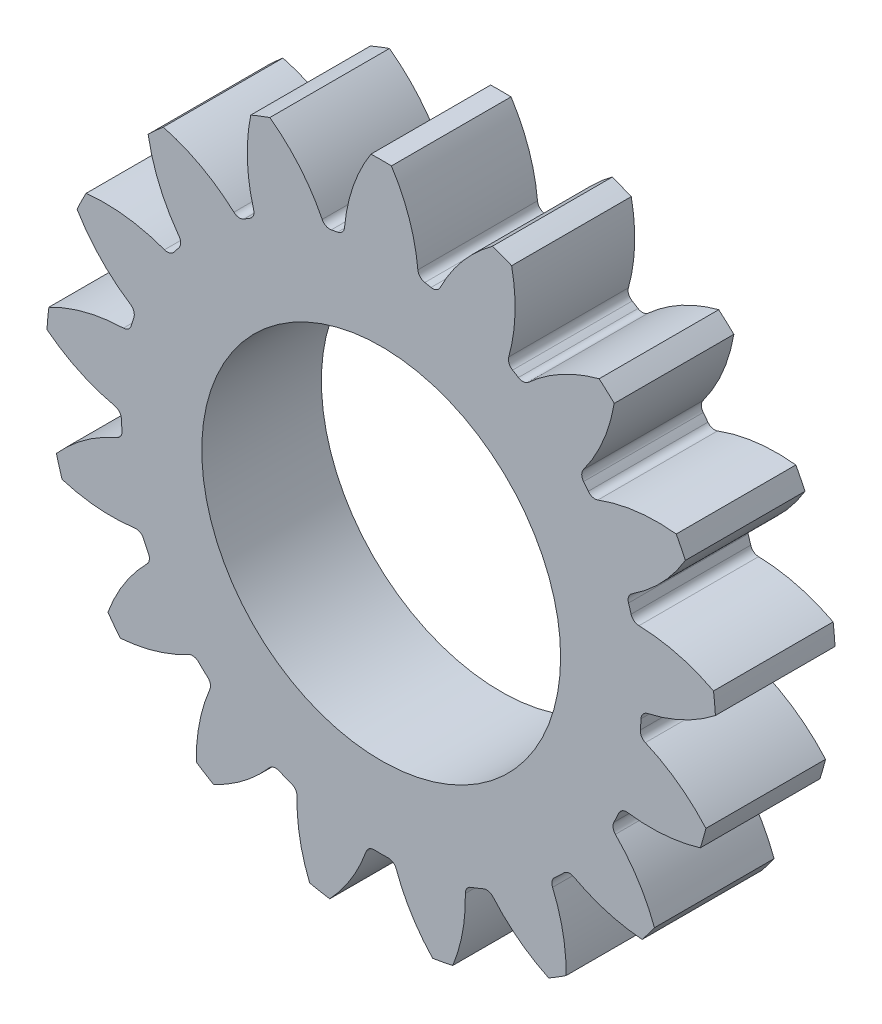
from build123d import *

# Parameters (mm, degrees)
SKETCH_1_R               = 10.875
EXTRUDE_1_DEPTH          = 5
EXTRUDE_2_DEPTH          = 5
FILLET_1_R               = 0.35
PATTERN_CIRCULAR_1_DEPTH = 5
CUT_EXTRUDE_1_REACH      = 22.572
SKETCH_2_R               = 7.5


# Read off the part's stored shape, not the designer's step: 원형 패턴1
with BuildPart() as part:
    # 스케치1 → 보스-돌출1 (new body)
    with BuildSketch(Plane.XY):
        Circle(SKETCH_1_R)
    extrude(amount=EXTRUDE_1_DEPTH)

    # 스케치1<3> → 보스-돌출2 (add)
    with BuildSketch(Plane.XY):
        with BuildLine():
            ThreePointArc((1.5525, 10.763613183), (1.216970842, 12.576974386), (0.4275, 14.243586057))
            ThreePointArc((0.4275, 14.243586057), (0, 14.25), (-0.4275, 14.243586057))
            ThreePointArc((-0.4275, 14.243586057), (-1.216970842, 12.576974386), (-1.5525, 10.763613183))
            ThreePointArc((-1.5525, 10.763613183), (0, 10.875), (1.5525, 10.763613183))
        make_face()
    extrude(amount=EXTRUDE_2_DEPTH)

    # 필렛1
    fillet_1_edges = [part.edges().sort_by_distance(p)[0] for p in [
        (-1.5525, 10.763613183, 2.5),
        (1.5525, 10.763613183, 2.5),
    ]]
    fillet(fillet_1_edges, radius=FILLET_1_R)

    # 원형 패턴1 outline → 원형 패턴1 (add)
    with BuildSketch(Plane.XY):
        with BuildLine():
            ThreePointArc((2.084837088, 10.673288121), (3.842906104, 10.173381821), (5.492422476, 9.386102511))
            ThreePointArc((5.492422476, 9.386102511), (5.344646109, 9.557145045), (5.332233471, 9.782842475))
            ThreePointArc((5.332233471, 9.782842475), (5.593355494, 11.4564781), (5.452236305, 13.144472855))
            ThreePointArc((5.452236305, 13.144472855), (5.055921411, 13.304884491), (4.654972549, 13.453334479))
            ThreePointArc((4.654972549, 13.453334479), (3.403689946, 12.289385973), (2.465385752, 10.861075951))
            ThreePointArc((2.465385752, 10.861075951), (2.306817266, 10.702930709), (2.084837088, 10.673288121))
        make_face()
        with BuildLine():
            ThreePointArc((5.736195698, 9.2391387), (7.199095251, 8.150990895), (8.459646862, 6.833739823))
            ThreePointArc((8.459646862, 6.833739823), (8.381997736, 7.045900933), (8.450146114, 7.261301773))
            ThreePointArc((8.450146114, 7.261301773), (9.274201483, 8.707038787), (9.740617886, 10.304436202))
            ThreePointArc((9.740617886, 10.304436202), (9.42901262, 10.597181051), (9.108765262, 10.880445977))
            ThreePointArc((9.108765262, 10.880445977), (7.536352291, 10.255192371), (6.155612256, 9.27693802))
            ThreePointArc((6.155612256, 9.27693802), (5.952224819, 9.187903085), (5.736195698, 9.2391387))
        make_face()
        with BuildLine():
            ThreePointArc((8.656847778, 6.582143386), (9.631277253, 5.050160738), (10.337248772, 3.377412148))
            ThreePointArc((10.337248772, 3.377412148), (10.339832595, 3.602419922), (10.478866532, 3.779351375))
            ThreePointArc((10.478866532, 3.779351375), (11.729603042, 4.815098477), (12.713475046, 6.107038785))
            ThreePointArc((12.713475046, 6.107038785), (12.528663426, 6.492580033), (12.332368752, 6.872403399))
            ThreePointArc((12.332368752, 6.872403399), (10.671238348, 6.86130469), (9.057778331, 6.466052652))
            ThreePointArc((9.057778331, 6.466052652), (8.838113972, 6.457792134), (8.656847778, 6.582143386))
        make_face()
        with BuildLine():
            ThreePointArc((10.44566348, 3.025514743), (10.802249116, 1.255802147), (10.861158072, -0.548516485))
            ThreePointArc((10.861158072, -0.548516485), (10.943077602, -0.34062274), (11.134084318, -0.224661311))
            ThreePointArc((11.134084318, -0.224661311), (12.626546762, 0.289328326), (13.969306954, 1.119162384))
            ThreePointArc((13.969306954, 1.119162384), (13.936248813, 1.545430549), (13.890417506, 1.970515105))
            ThreePointArc((13.890417506, 1.970515105), (12.377771936, 2.549980076), (10.773358461, 2.772990553))
            ThreePointArc((10.773358461, 2.772990553), (10.568207288, 2.845653785), (10.44566348, 3.025514743))
        make_face()
        with BuildLine():
            ThreePointArc((10.831434222, -0.972449329), (10.524388312, -2.739137757), (9.931200049, -4.431353133))
            ThreePointArc((9.931200049, -4.431353133), (10.080749628, -4.26807205), (10.298365111, -4.227215102))
            ThreePointArc((10.298365111, -4.227215102), (11.831510548, -4.270865326), (13.338506551, -3.985552654))
            ThreePointArc((13.338506551, -3.985552654), (13.461666574, -3.57612745), (13.572488407, -3.163191729))
            ThreePointArc((13.572488407, -3.163191729), (12.409057254, -2.103647039), (11.041512467, -1.325168872))
            ThreePointArc((11.041512467, -1.325168872), (10.879326869, -1.182845296), (10.831434222, -0.972449329))
        make_face()
        with BuildLine():
            ThreePointArc((9.724818044, -4.867600951), (8.799895988, -6.389636578), (7.638946645, -7.74029193))
            ThreePointArc((7.638946645, -7.74029193), (7.835322049, -7.642919348), (8.051101932, -7.68143897))
            ThreePointArc((8.051101932, -7.68143897), (9.434573038, -8.250170344), (10.906266927, -8.517686277))
            ThreePointArc((10.906266927, -8.517686277), (11.169011671, -8.180399177), (11.421519541, -7.835381548))
            ThreePointArc((11.421519541, -7.835381548), (10.743744256, -6.465085659), (9.78938361, -5.27081353))
            ThreePointArc((9.78938361, -5.27081353), (9.692203368, -5.079599132), (9.724818044, -4.867600951))
        make_face()
        with BuildLine():
            ThreePointArc((7.250855805, -8.104980882), (5.839114845, -9.174440736), (4.272503154, -10.000567074))
            ThreePointArc((4.272503154, -10.000567074), (4.488726043, -9.981391229), (4.674670149, -10.09339498))
            ThreePointArc((4.674670149, -10.09339498), (5.746046713, -11.099844355), (7.00107552, -11.865148727))
            ThreePointArc((7.00107552, -11.865148727), (7.367919852, -11.645552222), (7.728011172, -11.415049228))
            ThreePointArc((7.728011172, -11.415049228), (7.598229184, -9.929070664), (7.162058655, -8.502630716))
            ThreePointArc((7.162058655, -8.502630716), (7.142629708, -8.289552802), (7.250855805, -8.104980882))
        make_face()
        with BuildLine():
            ThreePointArc((3.745858716, -10.209513577), (2.04453627, -10.681081239), (0.289330355, -10.871150489))
            ThreePointArc((0.289330355, -10.871150489), (0.495925275, -10.93192564), (0.627834307, -11.102146342))
            ThreePointArc((0.627834307, -11.102146342), (1.261761796, -12.417365945), (2.150350071, -13.57584665))
            ThreePointArc((2.150350071, -13.57584665), (2.57174963, -13.503598465), (2.990792071, -13.418740812))
            ThreePointArc((2.990792071, -13.418740812), (3.40225572, -12.010026536), (3.516526006, -10.546906395))
            ThreePointArc((3.516526006, -10.546906395), (3.576953157, -10.341342504), (3.745858716, -10.209513577))
        make_face()
        with BuildLine():
            ThreePointArc((-0.289330355, -10.871150489), (-2.04453627, -10.681081239), (-3.745858716, -10.209513577))
            ThreePointArc((-3.745858716, -10.209513577), (-3.576953157, -10.341342504), (-3.516526006, -10.546906395))
            ThreePointArc((-3.516526006, -10.546906395), (-3.40225572, -12.010026536), (-2.990792071, -13.418740812))
            ThreePointArc((-2.990792071, -13.418740812), (-2.57174963, -13.503598465), (-2.150350071, -13.57584665))
            ThreePointArc((-2.150350071, -13.57584665), (-1.261761796, -12.417365945), (-0.627834307, -11.102146342))
            ThreePointArc((-0.627834307, -11.102146342), (-0.495925275, -10.93192564), (-0.289330355, -10.871150489))
        make_face()
        with BuildLine():
            ThreePointArc((-4.272503154, -10.000567074), (-5.839114845, -9.174440736), (-7.250855805, -8.104980882))
            ThreePointArc((-7.250855805, -8.104980882), (-7.142629708, -8.289552802), (-7.162058655, -8.502630716))
            ThreePointArc((-7.162058655, -8.502630716), (-7.598229184, -9.929070664), (-7.728011172, -11.415049228))
            ThreePointArc((-7.728011172, -11.415049228), (-7.367919852, -11.645552222), (-7.00107552, -11.865148727))
            ThreePointArc((-7.00107552, -11.865148727), (-5.746046713, -11.099844355), (-4.674670149, -10.09339498))
            ThreePointArc((-4.674670149, -10.09339498), (-4.488726043, -9.981391229), (-4.272503154, -10.000567074))
        make_face()
        with BuildLine():
            ThreePointArc((-7.638946645, -7.74029193), (-8.799895988, -6.389636578), (-9.724818044, -4.867600951))
            ThreePointArc((-9.724818044, -4.867600951), (-9.692203368, -5.079599132), (-9.78938361, -5.27081353))
            ThreePointArc((-9.78938361, -5.27081353), (-10.743744256, -6.465085659), (-11.421519541, -7.835381548))
            ThreePointArc((-11.421519541, -7.835381548), (-11.169011671, -8.180399177), (-10.906266927, -8.517686277))
            ThreePointArc((-10.906266927, -8.517686277), (-9.434573038, -8.250170344), (-8.051101932, -7.68143897))
            ThreePointArc((-8.051101932, -7.68143897), (-7.835322049, -7.642919348), (-7.638946645, -7.74029193))
        make_face()
        with BuildLine():
            ThreePointArc((-9.931200049, -4.431353133), (-10.524388312, -2.739137757), (-10.831434222, -0.972449329))
            ThreePointArc((-10.831434222, -0.972449329), (-10.879326869, -1.182845296), (-11.041512467, -1.325168872))
            ThreePointArc((-11.041512467, -1.325168872), (-12.409057254, -2.103647039), (-13.572488407, -3.163191729))
            ThreePointArc((-13.572488407, -3.163191729), (-13.461666574, -3.57612745), (-13.338506551, -3.985552654))
            ThreePointArc((-13.338506551, -3.985552654), (-11.831510548, -4.270865326), (-10.298365111, -4.227215102))
            ThreePointArc((-10.298365111, -4.227215102), (-10.080749628, -4.26807205), (-9.931200049, -4.431353133))
        make_face()
        with BuildLine():
            ThreePointArc((-10.861158072, -0.548516485), (-10.802249116, 1.255802147), (-10.44566348, 3.025514743))
            ThreePointArc((-10.44566348, 3.025514743), (-10.568207288, 2.845653785), (-10.773358461, 2.772990553))
            ThreePointArc((-10.773358461, 2.772990553), (-12.377771936, 2.549980076), (-13.890417506, 1.970515105))
            ThreePointArc((-13.890417506, 1.970515105), (-13.936248813, 1.545430549), (-13.969306954, 1.119162384))
            ThreePointArc((-13.969306954, 1.119162384), (-12.626546762, 0.289328326), (-11.134084318, -0.224661311))
            ThreePointArc((-11.134084318, -0.224661311), (-10.943077602, -0.34062274), (-10.861158072, -0.548516485))
        make_face()
        with BuildLine():
            ThreePointArc((-10.337248772, 3.377412148), (-9.631277253, 5.050160738), (-8.656847778, 6.582143386))
            ThreePointArc((-8.656847778, 6.582143386), (-8.838113972, 6.457792134), (-9.057778331, 6.466052652))
            ThreePointArc((-9.057778331, 6.466052652), (-10.671238348, 6.86130469), (-12.332368752, 6.872403399))
            ThreePointArc((-12.332368752, 6.872403399), (-12.528663426, 6.492580033), (-12.713475046, 6.107038785))
            ThreePointArc((-12.713475046, 6.107038785), (-11.729603042, 4.815098477), (-10.478866532, 3.779351375))
            ThreePointArc((-10.478866532, 3.779351375), (-10.339832595, 3.602419922), (-10.337248772, 3.377412148))
        make_face()
        with BuildLine():
            ThreePointArc((-8.459646862, 6.833739823), (-7.199095251, 8.150990895), (-5.736195698, 9.2391387))
            ThreePointArc((-5.736195698, 9.2391387), (-5.952224819, 9.187903085), (-6.155612256, 9.27693802))
            ThreePointArc((-6.155612256, 9.27693802), (-7.536352291, 10.255192371), (-9.108765262, 10.880445977))
            ThreePointArc((-9.108765262, 10.880445977), (-9.42901262, 10.597181051), (-9.740617886, 10.304436202))
            ThreePointArc((-9.740617886, 10.304436202), (-9.274201483, 8.707038787), (-8.450146114, 7.261301773))
            ThreePointArc((-8.450146114, 7.261301773), (-8.381997736, 7.045900933), (-8.459646862, 6.833739823))
        make_face()
        with BuildLine():
            ThreePointArc((-2.465385752, 10.861075951), (-3.403689946, 12.289385973), (-4.654972549, 13.453334479))
            ThreePointArc((-4.654972549, 13.453334479), (-5.055921411, 13.304884491), (-5.452236305, 13.144472855))
            ThreePointArc((-5.452236305, 13.144472855), (-5.593355494, 11.4564781), (-5.332233471, 9.782842475))
            ThreePointArc((-5.332233471, 9.782842475), (-5.344646109, 9.557145045), (-5.492422476, 9.386102511))
            ThreePointArc((-5.492422476, 9.386102511), (-3.842906104, 10.173381821), (-2.084837088, 10.673288121))
            ThreePointArc((-2.084837088, 10.673288121), (-2.306817266, 10.702930709), (-2.465385752, 10.861075951))
        make_face()
    extrude(amount=PATTERN_CIRCULAR_1_DEPTH)

    # 스케치2 → 컷-돌출1 (cut, up to next)
    with BuildSketch(Plane.XY.offset(5), mode=Mode.PRIVATE) as cut_extrude_1_sk1:
        Circle(SKETCH_2_R)
    cut_extrude_1_tool1 = extrude(cut_extrude_1_sk1.sketch, amount=-CUT_EXTRUDE_1_REACH, mode=Mode.PRIVATE) & part.part
    add(cut_extrude_1_tool1.solids().sort_by_distance((0, 0, 5))[0], mode=Mode.SUBTRACT)


solid = part.part
